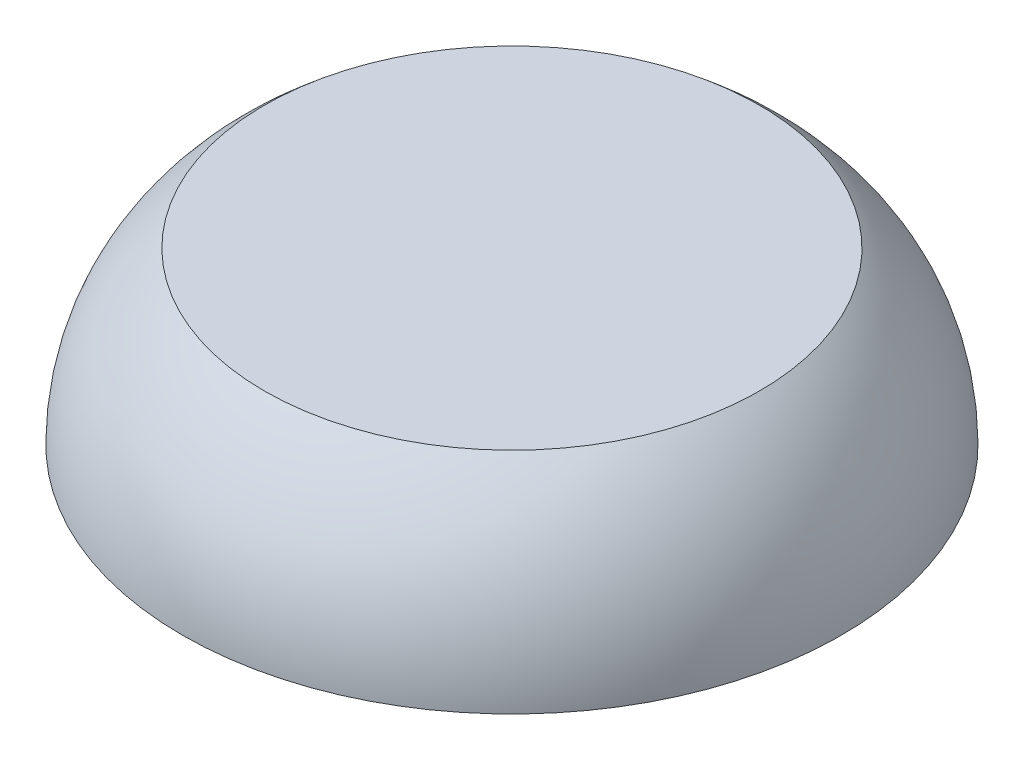
from build123d import *


with BuildPart() as part:
    # Sketch1 → Revolve1 (revolve)
    with BuildSketch(Plane.XY):
        with BuildLine():
            Line((2.178325455, -5.927518825), (0, -5.927518825))
            Line((0, -5.927518825), (0, -7.427518825))
            Line((0, -7.427518825), (2.9, -7.427518825))
            ThreePointArc((2.9, -7.427518825), (2.710198551, -6.595230691), (2.178325455, -5.927518825))
        make_face()
    revolve(axis=Axis((0, 0, 0), (0, -1, 0)))


solid = part.part
